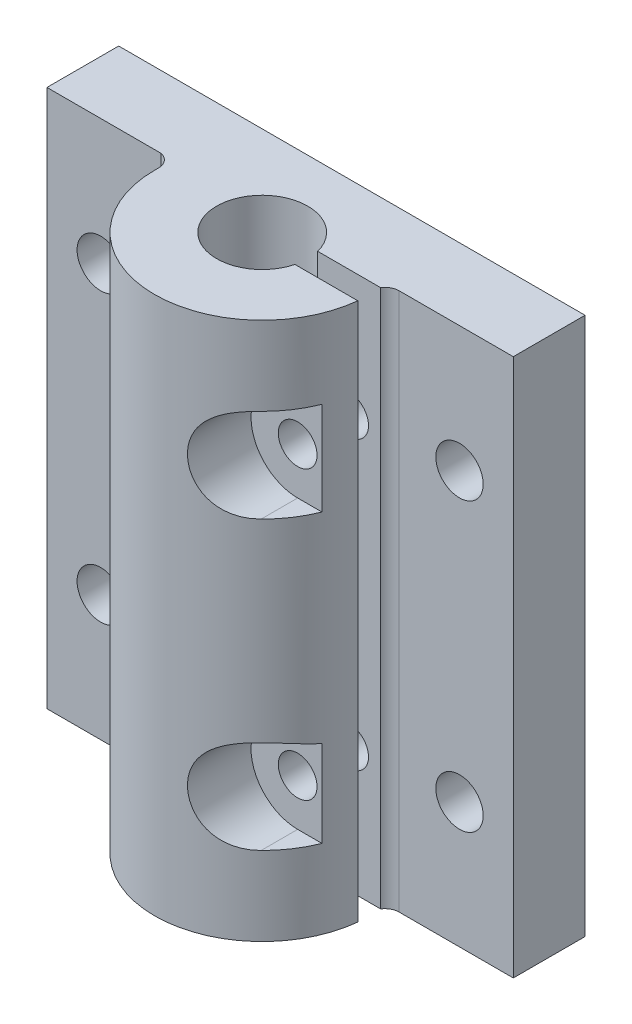
from build123d import *

# Parameters (mm, degrees)
BOSS_EXTRUDE1_DEPTH  = 37.5
M6_CLEARANCE_HOLE1_D = 6.6
SKETCH7_W            = 9.4125
SKETCH7_H            = 13
CUT_EXTRUDE1_DEPTH   = 3.388423
CUT_EXTRUDE3_DEPTH   = 6.9125
MIRROR1_START        = 18.0875
MIRROR1_DEPTH        = 8.860423859
MIRROR1_2_DEPTH      = 6.9125
MIRROR1_START_2      = 6.9125
MIRROR1_3_OUTLINE_R  = 2.7
MIRROR1_3_DEPTH      = 11.175


# Read off the part's stored shape, not the designer's step: Mirror1
with BuildPart() as part:
    # Sketch1 → Boss-Extrude1 (new, symmetric)
    with BuildSketch(Plane(origin=(0, 0, 0), x_dir=(1, 0, 0), z_dir=(0, 1, 0))):
        with BuildLine():
            Line((-32.5, 0), (32.5, 0))
            Line((32.5, 0), (32.5, -10))
            Line((32.5, -10), (16.594252725, -10))
            ThreePointArc((16.594252725, -10), (15.639004066, -10.242871661), (14.915758236, -10.9125))
            Line((14.915758236, -10.9125), (6.148361062, -10.9125))
            ThreePointArc((6.148361062, -10.9125), (-6.35, -12.5), (6.148361062, -14.0875))
            Line((6.148361062, -14.0875), (14.915758236, -14.0875))
            ThreePointArc((14.915758236, -14.0875), (-0.794866801, -27.478924753), (-15, -12.5))
            Line((-15, -12.5), (-15, -11.958409852))
            ThreePointArc((-15, -11.958409852), (-15.448952846, -10.695772642), (-16.594252725, -10))
            Line((-16.594252725, -10), (-32.5, -10))
            Line((-32.5, -10), (-32.5, 0))
        make_face()
    extrude(amount=BOSS_EXTRUDE1_DEPTH, both=True)

    # M6 Clearance Hole1 (through all)
    with Locations(Plane(origin=(0, 0, 0), x_dir=(-1, 0, 0), z_dir=(0, 0, -1))):
        with Locations((25, -20), (-25, 20), (-25, -20), (25, 20)):
            Hole(M6_CLEARANCE_HOLE1_D / 2)

    # Sketch6 → Cut-Revolve1 (revolve, cut)
    with BuildSketch(Plane(origin=(10.532059649, 0, 0), x_dir=(0, 0, -1), z_dir=(1, 0, 0))):
        Polygon((0, 20), (-27.5, 20), (-27.5, 26.5), (-18.0875, 26.5), (-18.0875, 22.7), (0, 22.7), align=None)
    revolve(axis=Axis((10.532059649, 20, 0), (0, 0, 1)), mode=Mode.SUBTRACT)

    # Sketch7 → Cut-Extrude1 (cut)
    with BuildSketch(Plane(origin=(10.532059649, 0, 0), x_dir=(0, 0, -1), z_dir=(1, 0, 0))):
        with Locations((-22.79375, 20)):
            Rectangle(SKETCH7_W, SKETCH7_H)
    extrude(amount=CUT_EXTRUDE1_DEPTH, mode=Mode.SUBTRACT)

    # Sketch9 → Cut-Extrude3 (cut)
    with BuildSketch(Plane(origin=(0, 0, 0), x_dir=(-1, 0, 0), z_dir=(0, 0, -1))):
        Polygon((-6.282059649, 17.546261356), (-6.282059649, 22.453738644), (-10.532059649, 24.907477288), (-14.782059649, 22.453738644), (-14.782059649, 17.546261356), (-10.532059649, 15.092522712), align=None)
    extrude(amount=-CUT_EXTRUDE3_DEPTH, mode=Mode.SUBTRACT)

    # Mirror1 outline → Mirror1 (cut)
    with BuildSketch(Plane.XY.offset(MIRROR1_START)):
        with BuildLine():
            ThreePointArc((13.920482885, -14.453055979), (4.274858352, -18.240047747), (10.532059649, -26.5))
            Line((10.532059649, -26.5), (16, -26.5))
            Line((16, -26.5), (16, -15.723356181))
            Line((16, -15.723356181), (13.920482885, -14.453055979))
        make_face()
    extrude(amount=MIRROR1_DEPTH, mode=Mode.SUBTRACT)

    # Mirror1 2 outline → Mirror1 2 (cut)
    with BuildSketch(Plane.XY):
        Polygon((14.782059649, -22.453738644), (14.782059649, -17.546261356), (10.532059649, -15.092522712), (6.282059649, -17.546261356), (6.282059649, -22.453738644), (10.532059649, -24.907477288), align=None)
    extrude(amount=MIRROR1_2_DEPTH, mode=Mode.SUBTRACT)

    # Mirror1 3 outline → Mirror1 3 (cut)
    with BuildSketch(Plane.XY.offset(MIRROR1_START_2)):
        with Locations((10.532059649, -20)):
            Circle(MIRROR1_3_OUTLINE_R)
    extrude(amount=MIRROR1_3_DEPTH, mode=Mode.SUBTRACT)


solid = part.part
